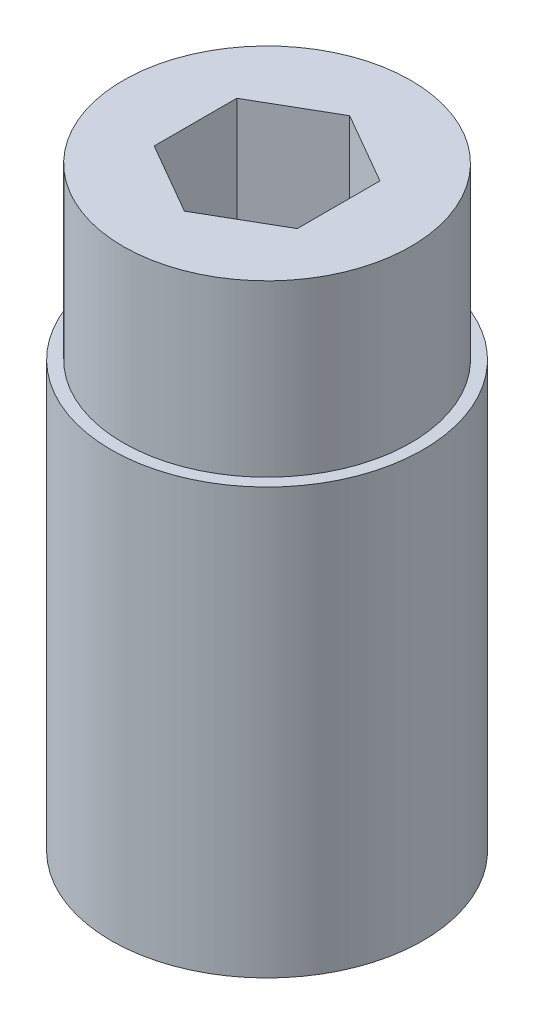
from build123d import *

# Parameters (mm, degrees)
SKETCH1_R           = 7
BOSS_EXTRUDE1_DEPTH = 15
SKETCH2_R           = 5.075
BOSS_EXTRUDE2_DEPTH = 6
CUT_EXTRUDE2_DEPTH  = 24.216373532
SKETCH5_OUTSIDE_W   = 21.772
SKETCH5_OUTSIDE_H   = 21.772
SKETCH5_OUTSIDE_R   = 5.5
CUT_EXTRUDE3_DEPTH  = 18.972200756


with BuildPart() as part:
    # Sketch1 → Boss-Extrude1 (new body)
    with BuildSketch(Plane(origin=(0, 0, 0), x_dir=(1, 0, 0), z_dir=(0, 1, 0))):
        Circle(SKETCH1_R)
    extrude(amount=BOSS_EXTRUDE1_DEPTH)

    # Sketch2 → Boss-Extrude2 (add)
    with BuildSketch(Plane(origin=(0, 15, 0), x_dir=(1, 0, 0), z_dir=(0, 1, 0))):
        Circle(SKETCH2_R)
    extrude(amount=BOSS_EXTRUDE2_DEPTH)

    # Sketch4 → Cut-Extrude2 (cut, through all)
    with BuildSketch(Plane(origin=(0, 21, 0), x_dir=(1, 0, 0), z_dir=(0, 1, 0))):
        Polygon((2.525, 1.45780943), (0, 2.915618859), (-2.525, 1.45780943), (-2.525, -1.45780943), (0, -2.915618859), (2.525, -1.45780943), align=None)
    extrude(amount=-CUT_EXTRUDE2_DEPTH, mode=Mode.SUBTRACT)

    # Sketch5 outside → Cut-Extrude3 (cut, through all)
    with BuildSketch(Plane(origin=(0, 15, 0), x_dir=(1, 0, 0), z_dir=(0, 1, 0))):
        Rectangle(SKETCH5_OUTSIDE_W, SKETCH5_OUTSIDE_H)
        Circle(SKETCH5_OUTSIDE_R, mode=Mode.SUBTRACT)
    extrude(amount=-CUT_EXTRUDE3_DEPTH, mode=Mode.SUBTRACT)


solid = part.part
